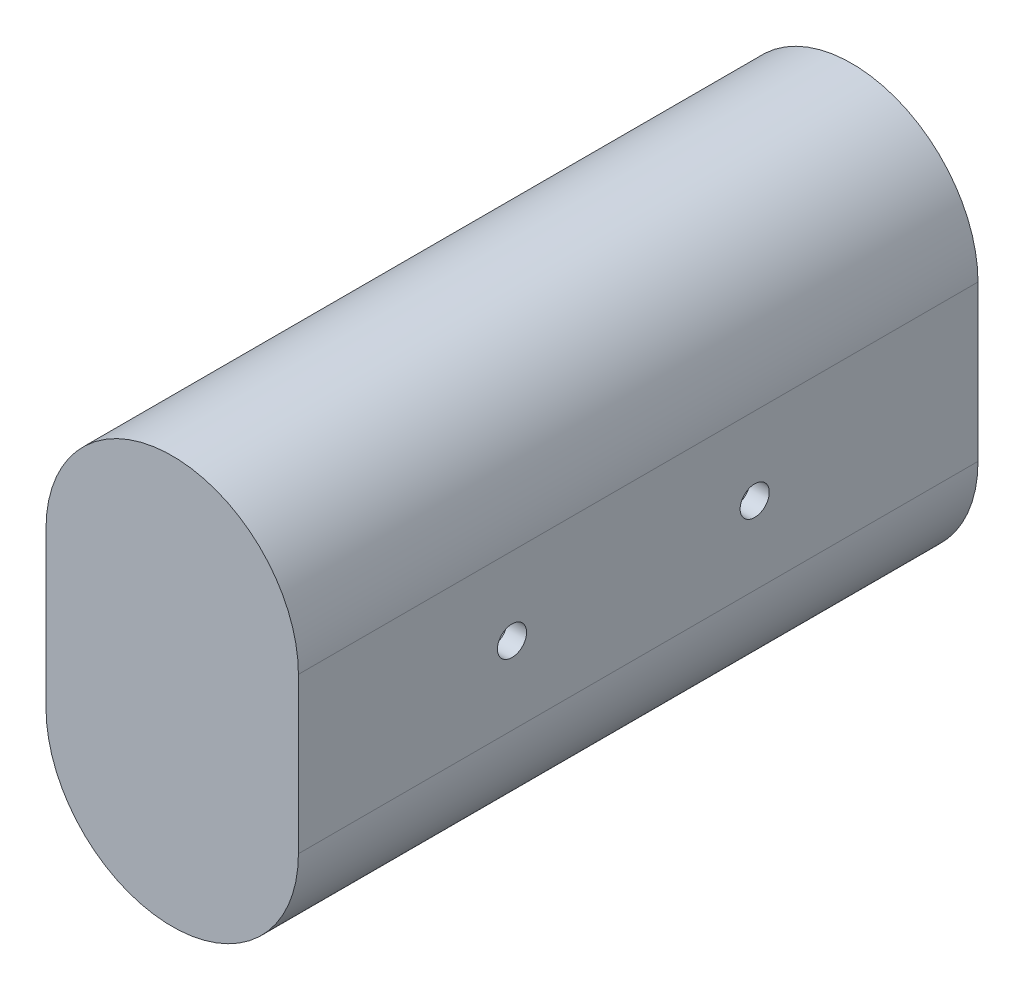
from build123d import *

# Parameters (mm, degrees)
BOSS_EXTRU_1_DEPTH  = 70
CUT_EXTRUDE1_REACH  = 81.48
SKETCH1_R           = 1.5
CUT_EXTRUDE2_REACH  = 82.106
BOSS_EXTRUDE1_START = -2
BOSS_EXTRUDE1_DEPTH = 2


with BuildPart() as part:
    # Esquisse1 → Boss.-Extru.1 (new body)
    with BuildSketch(Plane.XY):
        with BuildLine():
            Line((0, 0), (0, 16))
            ThreePointArc((0, 16), (13, 29), (26, 16))
            Line((26, 16), (26, 0))
            ThreePointArc((26, 0), (13, -13), (0, 0))
        make_face()
        with BuildLine():
            Line((2, 0), (2, 16))
            ThreePointArc((2, 16), (13, 27), (24, 16))
            Line((24, 16), (24, 0))
            ThreePointArc((24, 0), (13, -11), (2, 0))
        make_face(mode=Mode.SUBTRACT)
    extrude(amount=BOSS_EXTRU_1_DEPTH)

    # Sketch1 → Cut-Extrude1 (cut, up to next)
    with BuildSketch(Plane(origin=(24, 0, 0), x_dir=(0, -1, 0), z_dir=(-1, 0, 0)), mode=Mode.PRIVATE) as cut_extrude1_sk1:
        with Locations((-8, 23)):
            Circle(SKETCH1_R)
    cut_extrude1_tool1 = extrude(cut_extrude1_sk1.sketch, amount=-CUT_EXTRUDE1_REACH, mode=Mode.PRIVATE) & part.part
    # Sketch1 → Cut-Extrude1 (cut, up to next)
    with BuildSketch(Plane(origin=(24, 0, 0), x_dir=(0, -1, 0), z_dir=(-1, 0, 0)), mode=Mode.PRIVATE) as cut_extrude1_sk2:
        with Locations((-8, 48)):
            Circle(SKETCH1_R)
    cut_extrude1_tool2 = extrude(cut_extrude1_sk2.sketch, amount=-CUT_EXTRUDE1_REACH, mode=Mode.PRIVATE) & part.part
    add(cut_extrude1_tool1.solids().sort_by_distance((24, 8, 23))[0], mode=Mode.SUBTRACT)
    add(cut_extrude1_tool2.solids().sort_by_distance((24, 8, 48))[0], mode=Mode.SUBTRACT)

    # Sketch2 → Cut-Extrude2 (cut, up to next)
    with BuildSketch(Plane(origin=(0, 0, 0), x_dir=(0, -1, 0), z_dir=(-1, 0, 0)), mode=Mode.PRIVATE) as cut_extrude2_sk1:
        with BuildLine():
            Line((-13, 18), (-13, 48))
            ThreePointArc((-13, 48), (-8, 53), (-3, 48))
            Line((-3, 48), (-3, 18))
            ThreePointArc((-3, 18), (-8, 13), (-13, 18))
        make_face()
    cut_extrude2_tool1 = extrude(cut_extrude2_sk1.sketch, amount=-CUT_EXTRUDE2_REACH, mode=Mode.PRIVATE) & part.part
    add(cut_extrude2_tool1.solids().sort_by_distance((0, 8, 33))[0], mode=Mode.SUBTRACT)

    # Sketch3 → Boss-Extrude1 (add)
    with BuildSketch(Plane.XY.offset(70).offset(BOSS_EXTRUDE1_START)):
        with BuildLine():
            Line((26, 0), (26, 16))
            ThreePointArc((26, 16), (13, 29), (0, 16))
            Line((0, 16), (0, 0))
            ThreePointArc((0, 0), (13, -13), (26, 0))
        make_face()
    extrude(amount=BOSS_EXTRUDE1_DEPTH)


solid = part.part
